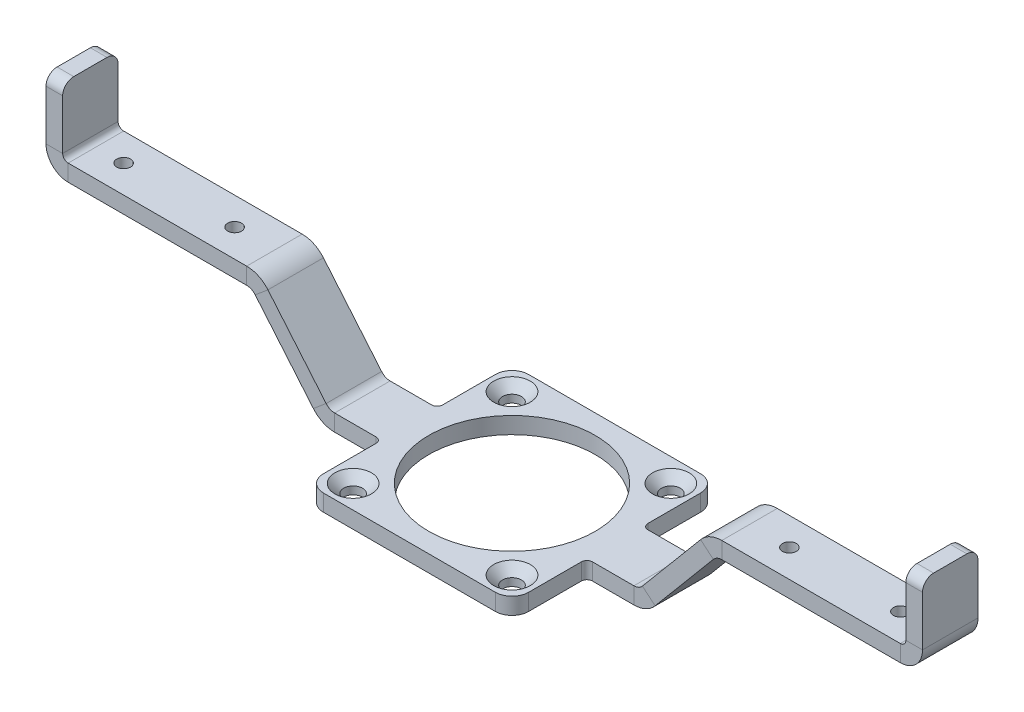
from build123d import *

# Parameters (mm, degrees)
SKETCH_1_W                  = 37
SKETCH_1_H                  = 37
SKETCH_1_R                  = 15
SKETCH_1_R_2                = 1.65
SM_BASE_FLANGE_1_DEPTH      = 3
FILLET_1_R                  = 3
SKETCH_6_W                  = 56.5
SKETCH_6_H                  = 10
EXTRUDE_1_DEPTH             = 3
OTHER_START                 = -5
OTHER_1_DEPTH               = 10
OTHER_1_2_DEPTH             = 10
OTHER_2_DEPTH               = 10
OTHER_2_2_DEPTH             = 10
SM_EDGE_FLANGE_1_DEPTH      = 10
SM_EDGE_FLANGE_2_DEPTH      = 10
SKETCH_18_R                 = 1
CUT_EXTRUDE_2_DEPTH         = 10
HOLE_WIZARD_M3_2_AT_2_COUNT = 2
HOLE_WIZARD_M3_2_AT_2_PITCH = 28.637824638
HOLE_WIZARD_M3_2_AT_3_COUNT = 2
HOLE_WIZARD_M3_2_AT_3_PITCH = 40.5
HOLE_WIZARD_M3_2_AT_4_COUNT = 2
HOLE_WIZARD_M3_2_AT_4_PITCH = 28.637824638
HOLE_WIZARD_M3_2_2_D        = 2.5
FILLET_2_R                  = 2
FILLET_3_R                  = 1


# Read off the part's stored shape, not the designer's step: 转折1, 转折2
# Sheet-metal steps are written as plain solids
with BuildPart() as part:
    # Sketch 1 → 基体-法兰1 (new body)
    with BuildSketch(Plane(origin=(0, 0, 0), x_dir=(1, 0, 0), z_dir=(0, 1, 0))):
        Rectangle(SKETCH_1_W, SKETCH_1_H)
        with Locations(Location((0, 0, 0), (0, 0, 270))):
            Circle(SKETCH_1_R, mode=Mode.SUBTRACT)
        with Locations(Location((-14.318912319, 14.318912319, 0), (0, 0, 270))):
            Circle(SKETCH_1_R_2, mode=Mode.SUBTRACT)
        with Locations(Location((14.318912319, 14.318912319, 0), (0, 0, 270))):
            Circle(SKETCH_1_R_2, mode=Mode.SUBTRACT)
        with Locations(Location((14.318912319, -14.318912319, 0), (0, 0, 270))):
            Circle(SKETCH_1_R_2, mode=Mode.SUBTRACT)
        with Locations(Location((-14.318912319, -14.318912319, 0), (0, 0, 270))):
            Circle(SKETCH_1_R_2, mode=Mode.SUBTRACT)
    extrude(amount=-SM_BASE_FLANGE_1_DEPTH)

    # 圆角1
    fillet_1_edges = [part.edges().sort_by_distance(p)[0] for p in [
        (18.5, -1.5, 18.5),
        (-18.5, -1.5, 18.5),
        (-18.5, -1.5, -18.5),
        (18.5, -1.5, -18.5),
    ]]
    fillet(fillet_1_edges, radius=FILLET_1_R)

    # 草图6 → 凸台-拉伸1 (add)
    with BuildSketch(Plane(origin=(0, 0, 0), x_dir=(1, 0, 0), z_dir=(0, 1, 0))):
        with Locations((-46.75, 0)):
            Rectangle(SKETCH_6_W, SKETCH_6_H)
        with Locations((46.75, 0)):
            Rectangle(SKETCH_6_W, SKETCH_6_H)
    extrude(amount=-EXTRUDE_1_DEPTH)

    # Other 1 outline → Other 1 (cut)
    with BuildSketch(Plane.XY.offset(OTHER_START)):
        with BuildLine():
            ThreePointArc((-26.972836905, -3), (-29.085928213, -2.531538935), (-30.80305912, -1.213938048))
            Line((-30.80305912, -1.213938048), (-31.821674088, 0))
            Line((-31.821674088, 0), (-75, 0))
            Line((-75, 0), (-75, -3))
            Line((-75, -3), (-26.972836905, -3))
        make_face()
    extrude(amount=OTHER_1_DEPTH, mode=Mode.SUBTRACT)

    # Other 1 2 outline → Other 1 2 (add)
    with BuildSketch(Plane.XY.offset(OTHER_START)):
        with BuildLine():
            Line((-41.291396093, 11.285575219), (-31.821674088, 0))
            Line((-31.821674088, 0), (-26.972836905, 0))
            ThreePointArc((-26.972836905, 0), (-27.818073428, 0.187384426), (-28.504925791, 0.714424781))
            Line((-28.504925791, 0.714424781), (-38.993262764, 13.213938048))
            ThreePointArc((-38.993262764, 13.213938048), (-40.710393671, 14.531538935), (-42.823484979, 15))
            Line((-42.823484979, 15), (-75, 15))
            Line((-75, 15), (-75, 12))
            Line((-75, 12), (-42.823484979, 12))
            ThreePointArc((-42.823484979, 12), (-41.978248456, 11.812615574), (-41.291396093, 11.285575219))
        make_face()
    extrude(amount=OTHER_1_2_DEPTH)

    # Other 2 outline → Other 2 (cut)
    with BuildSketch(Plane.XY.offset(OTHER_START)):
        with BuildLine():
            Line((75, 0), (31.821674088, 0))
            Line((31.821674088, 0), (30.80305912, -1.213938048))
            ThreePointArc((30.80305912, -1.213938048), (29.085928213, -2.531538935), (26.972836905, -3))
            Line((26.972836905, -3), (75, -3))
            Line((75, -3), (75, 0))
        make_face()
    extrude(amount=OTHER_2_DEPTH, mode=Mode.SUBTRACT)

    # Other 2 2 outline → Other 2 2 (add)
    with BuildSketch(Plane.XY.offset(OTHER_START)):
        with BuildLine():
            Line((42.823484979, 12), (75, 12))
            Line((75, 12), (75, 15))
            Line((75, 15), (42.823484979, 15))
            ThreePointArc((42.823484979, 15), (40.710393671, 14.531538935), (38.993262764, 13.213938048))
            Line((38.993262764, 13.213938048), (28.504925791, 0.714424781))
            ThreePointArc((28.504925791, 0.714424781), (27.818073428, 0.187384426), (26.972836905, 0))
            Line((26.972836905, 0), (31.821674088, 0))
            Line((31.821674088, 0), (41.291396093, 11.285575219))
            ThreePointArc((41.291396093, 11.285575219), (41.978248456, 11.812615574), (42.823484979, 12))
        make_face()
    extrude(amount=OTHER_2_2_DEPTH)

    # 边线-法兰1 section (across the edge) → 边线-法兰1 (add)
    with BuildSketch(Plane(origin=(76, 15, 5), x_dir=(-1, 0, 0), z_dir=(0, 0, -1))):
        with BuildLine():
            Line((-3, 1), (-3, 12))
            Line((-3, 12), (0, 12))
            Line((0, 12), (0, 1))
            ThreePointArc((0, 1), (0.292893219, 0.292893219), (1, 0))
            Line((1, 0), (1, -3))
            ThreePointArc((1, -3), (-1.828427125, -1.828427125), (-3, 1))
        make_face()
    extrude(amount=SM_EDGE_FLANGE_1_DEPTH)

    # 边线-法兰2 section (across the edge) → 边线-法兰2 (add)
    with BuildSketch(Plane(origin=(-76, 15, -5), x_dir=(1, 0, 0), z_dir=(0, 0, 1))):
        with BuildLine():
            Line((-3, 1), (-3, 12))
            Line((-3, 12), (0, 12))
            Line((0, 12), (0, 1))
            ThreePointArc((0, 1), (0.292893219, 0.292893219), (1, 0))
            Line((1, 0), (1, -3))
            ThreePointArc((1, -3), (-1.828427125, -1.828427125), (-3, 1))
        make_face()
    extrude(amount=SM_EDGE_FLANGE_2_DEPTH)

    # 草图18 → 切除-拉伸2 (cut)
    with BuildSketch(Plane.ZX.offset(15)):
        with Locations(Location((0, 50, 0), (0, 0, 270))):
            Circle(SKETCH_18_R)
        with Locations(Location((0, 70, 0), (0, 0, 270))):
            Circle(SKETCH_18_R)
        with Locations((0, -70)):
            Circle(SKETCH_18_R)
        with Locations((0, -50)):
            Circle(SKETCH_18_R)
    extrude(amount=-CUT_EXTRUDE_2_DEPTH, mode=Mode.SUBTRACT)

    # 草图24 → Hole Wizard M3 _2 (revolve, cut)
    with BuildSketch(Plane(origin=(-14.318912319, 0, -14.318912319), x_dir=(0, 0, 1), z_dir=(1, 0, 0))):
        Polygon((0, 0), (0, 3), (1.7, 3), (1.7, 1.6), (3.3, 0), align=None)
    hole_wizard_m3_2 = revolve(axis=Axis((-14.318912319, 6.35, -14.318912319), (0, -1, 0)), mode=Mode.SUBTRACT)

    # Hole Wizard M3 _2 at 2: Hole Wizard M3 _2 ×2
    with Locations(*[(i * HOLE_WIZARD_M3_2_AT_2_PITCH, 0, 0) for i in range(1, HOLE_WIZARD_M3_2_AT_2_COUNT)]):
        add(hole_wizard_m3_2, mode=Mode.SUBTRACT)

    # Hole Wizard M3 _2 at 3: Hole Wizard M3 _2 ×2
    with Locations(*[Vector(0.7071067811865451, 0, 0.70710678118655) * (i * HOLE_WIZARD_M3_2_AT_3_PITCH) for i in range(1, HOLE_WIZARD_M3_2_AT_3_COUNT)]):
        add(hole_wizard_m3_2, mode=Mode.SUBTRACT)

    # Hole Wizard M3 _2 at 4: Hole Wizard M3 _2 ×2
    with Locations(*[(0, 0, i * HOLE_WIZARD_M3_2_AT_4_PITCH) for i in range(1, HOLE_WIZARD_M3_2_AT_4_COUNT)]):
        add(hole_wizard_m3_2, mode=Mode.SUBTRACT)

    # Hole Wizard M3 _2 2 (through all)
    with Locations(Plane(origin=(0, 15, 0), x_dir=(1, 0, 0), z_dir=(0, 1, 0))):
        with Locations((-70, 0), (-50, 0), (50, 0), (70, 0)):
            Hole(HOLE_WIZARD_M3_2_2_D / 2)

    # 圆角2
    fillet_2_edges = [part.edges().sort_by_distance(p)[0] for p in [
        (77.5, 27, 5),
        (77.5, 27, -5),
        (-77.5, 27, -5),
        (-77.5, 27, 5),
    ]]
    fillet(fillet_2_edges, radius=FILLET_2_R)

    # 圆角3
    fillet_3_edges = [part.edges().sort_by_distance(p)[0] for p in [
        (18.5, -1.5, -5),
        (18.5, -1.5, 5),
        (-18.5, -1.5, -5),
        (-18.5, -1.5, 5),
    ]]
    fillet(fillet_3_edges, radius=FILLET_3_R)


solid = part.part
